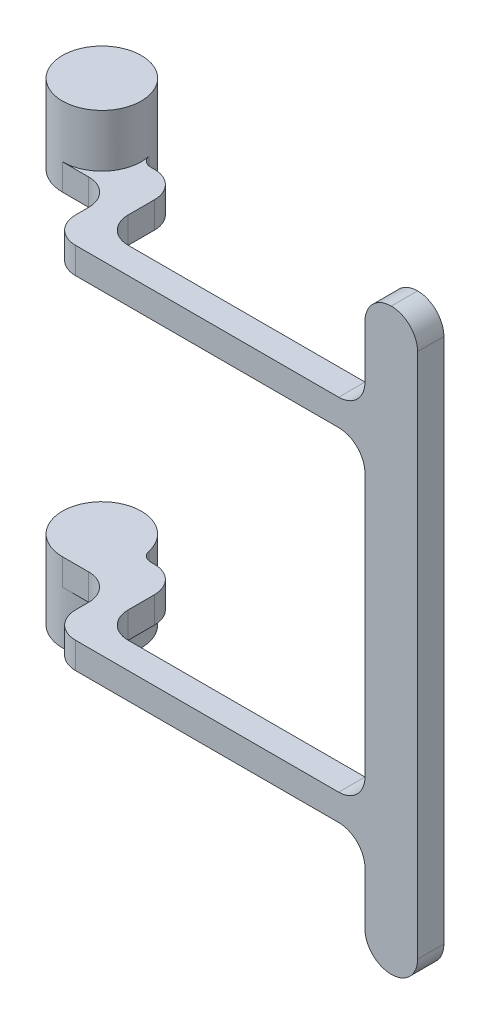
from build123d import *

# Parameters (mm, degrees)
ESQUISSE2_R        = 7.5
BOSS_EXTRU_1_DEPTH = 10
BOSS_EXTRU_2_DEPTH = 5
CONG_2_R           = 5
CONG_3_R           = 2
ESQUISSE4_W        = 5
ESQUISSE4_H        = 110
BOSS_EXTRU_3_DEPTH = 10
SYM_TRIE3_START    = 75
SYM_TRIE3_DEPTH    = 5
ESQUISSE5_R        = 7.5
BOSS_EXTRU_4_DEPTH = 10
CONG_4_START       = -1.578947368
CONG_4_DEPTH       = 22.578947368
CONG_4_START_2     = 15
CONG_4_2_DEPTH     = 5


with BuildPart() as part:
    # Esquisse2 → Boss.-Extru.1 (new body)
    with BuildSketch(Plane(origin=(0, 0, 0), x_dir=(1, 0, 0), z_dir=(0, 1, 0))):
        with Locations(Location((0, 0, 0), (0, 0, 270))):
            Circle(ESQUISSE2_R)
    extrude(amount=BOSS_EXTRU_1_DEPTH)

    # Esquisse3 → Boss.-Extru.2 (add)
    with BuildSketch(Plane(origin=(0, 10, 0), x_dir=(1, 0, 0), z_dir=(0, 1, 0))):
        with BuildLine():
            Line((15, 0), (15, -15))
            Line((15, -15), (70, -15))
            Line((70, -15), (70, -20))
            Line((70, -20), (10, -20))
            Line((10, -20), (10, -7.5))
            Line((10, -7.5), (0, -7.5))
            ThreePointArc((0, -7.5), (-5.303300859, 5.303300859), (7.5, 0))
            Line((7.5, 0), (15, 0))
        make_face()
    extrude(amount=BOSS_EXTRU_2_DEPTH)

    # Congé2
    cong_2_edges = [part.edges().sort_by_distance(p)[0] for p in [
        (10, 12.5, 20),
        (15, 12.5, 15),
        (15, 12.5, 0),
        (10, 12.5, 7.5),
    ]]
    fillet(cong_2_edges, radius=CONG_2_R)

    # Congé3
    cong_3_edges = [part.edges().sort_by_distance(p)[0] for p in [
        (7.5, 12.5, 0),
    ]]
    fillet(cong_3_edges, radius=CONG_3_R)

    # Esquisse4 → Boss.-Extru.3 (add)
    with BuildSketch(Plane(origin=(70, 0, 0), x_dir=(0, 0, -1), z_dir=(1, 0, 0))):
        with Locations((-17.5, 45)):
            Rectangle(ESQUISSE4_W, ESQUISSE4_H)
    extrude(amount=BOSS_EXTRU_3_DEPTH)

    # Symétrie3: read off the stored shape, not the designer's step
    # Symétrie3 outline → Symétrie3 (add)
    with BuildSketch(Plane(origin=(0, 0, 0), x_dir=(1, 0, 0), z_dir=(0, 1, 0)).offset(SYM_TRIE3_START)):
        with BuildLine():
            ThreePointArc((9.287087811, 0), (8.030526086, 0.44402679), (7.331911429, 1.578947368))
            ThreePointArc((7.331911429, 1.578947368), (-5.834899539, 4.712106468), (0, -7.5))
            Line((0, -7.5), (5, -7.5))
            ThreePointArc((5, -7.5), (8.535533906, -8.964466094), (10, -12.5))
            Line((10, -12.5), (10, -15))
            ThreePointArc((10, -15), (11.464466094, -18.535533906), (15, -20))
            Line((15, -20), (70, -20))
            Line((70, -20), (70, -15))
            Line((70, -15), (20, -15))
            ThreePointArc((20, -15), (16.464466094, -13.535533906), (15, -10))
            Line((15, -10), (15, -5))
            ThreePointArc((15, -5), (13.535533906, -1.464466094), (10, 0))
            Line((10, 0), (9.287087811, 0))
        make_face()
    extrude(amount=SYM_TRIE3_DEPTH)

    # Esquisse5 → Boss.-Extru.4 (add)
    with BuildSketch(Plane(origin=(0, 80, 0), x_dir=(1, 0, 0), z_dir=(0, 1, 0))):
        with Locations(Location((0, 0, 0), (0, 0, 270))):
            Circle(ESQUISSE5_R)
    extrude(amount=BOSS_EXTRU_4_DEPTH)

    # Congé4: read off the stored shape, not the designer's step
    # Congé4 outline → Congé4 (cut)
    with BuildSketch(Plane.XY.offset(CONG_4_START)):
        with BuildLine():
            Line((70, -10), (75, -10))
            ThreePointArc((75, -10), (71.464466094, -8.535533906), (70, -5))
            Line((70, -5), (70, -10))
        make_face()
        with BuildLine():
            Line((80, -10), (80, -5))
            ThreePointArc((80, -5), (78.535533906, -8.535533906), (75, -10))
            Line((75, -10), (80, -10))
        make_face()
        with BuildLine():
            Line((80, 100), (75, 100))
            ThreePointArc((75, 100), (78.535533906, 98.535533906), (80, 95))
            Line((80, 95), (80, 100))
        make_face()
        with BuildLine():
            Line((70, 100), (70, 95))
            ThreePointArc((70, 95), (71.464466094, 98.535533906), (75, 100))
            Line((75, 100), (70, 100))
        make_face()
    extrude(amount=CONG_4_DEPTH, mode=Mode.SUBTRACT)

    # Cong_4 2 outline → Cong_4 2 (add)
    with BuildSketch(Plane.XY.offset(CONG_4_START_2)):
        with BuildLine():
            Line((70, 15), (70, 20))
            ThreePointArc((70, 20), (68.535533906, 16.464466094), (65, 15))
            Line((65, 15), (70, 15))
        make_face()
        with BuildLine():
            ThreePointArc((65, 75), (68.535533906, 73.535533906), (70, 70))
            Line((70, 70), (70, 75))
            Line((70, 75), (65, 75))
        make_face()
        with BuildLine():
            Line((70, 80), (70, 85))
            ThreePointArc((70, 85), (68.535533906, 81.464466094), (65, 80))
            Line((65, 80), (70, 80))
        make_face()
        with BuildLine():
            ThreePointArc((65, 10), (68.535533906, 8.535533906), (70, 5))
            Line((70, 5), (70, 10))
            Line((70, 10), (65, 10))
        make_face()
    extrude(amount=CONG_4_2_DEPTH)


solid = part.part
